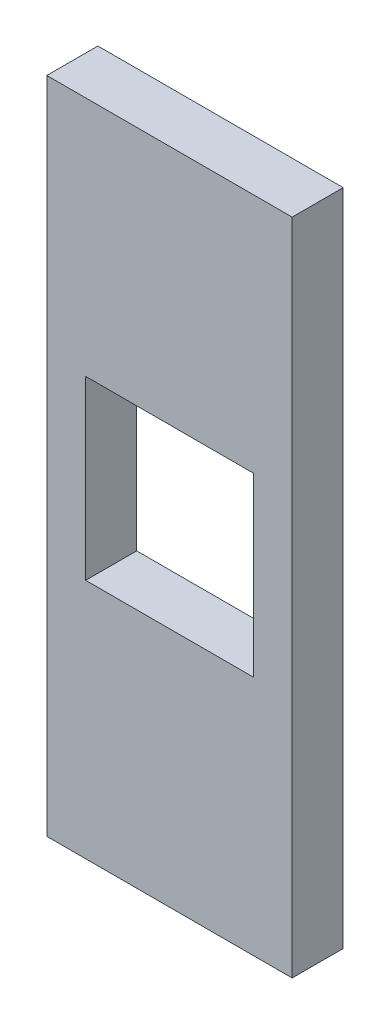
from build123d import *

# Parameters (mm, degrees)
SKETCH1_W           = 17.08
SKETCH1_H           = 18
BOSS_EXTRUDE1_DEPTH = 5.2


with BuildPart() as part:
    # Sketch1 → Boss-Extrude1 (new body)
    with BuildSketch(Plane.XY):
        Polygon((0, 67.15), (0, 44.75), (0, 39.55), (0, 27.6), (0, 22.4), (0, 0), (25, 0), (25, 22.4), (25, 27.6), (25, 39.55), (25, 44.75), (25, 67.15), align=None)
        with Locations((12.5, 33.575)):
            Rectangle(SKETCH1_W, SKETCH1_H, mode=Mode.SUBTRACT)
    extrude(amount=BOSS_EXTRUDE1_DEPTH)


solid = part.part
